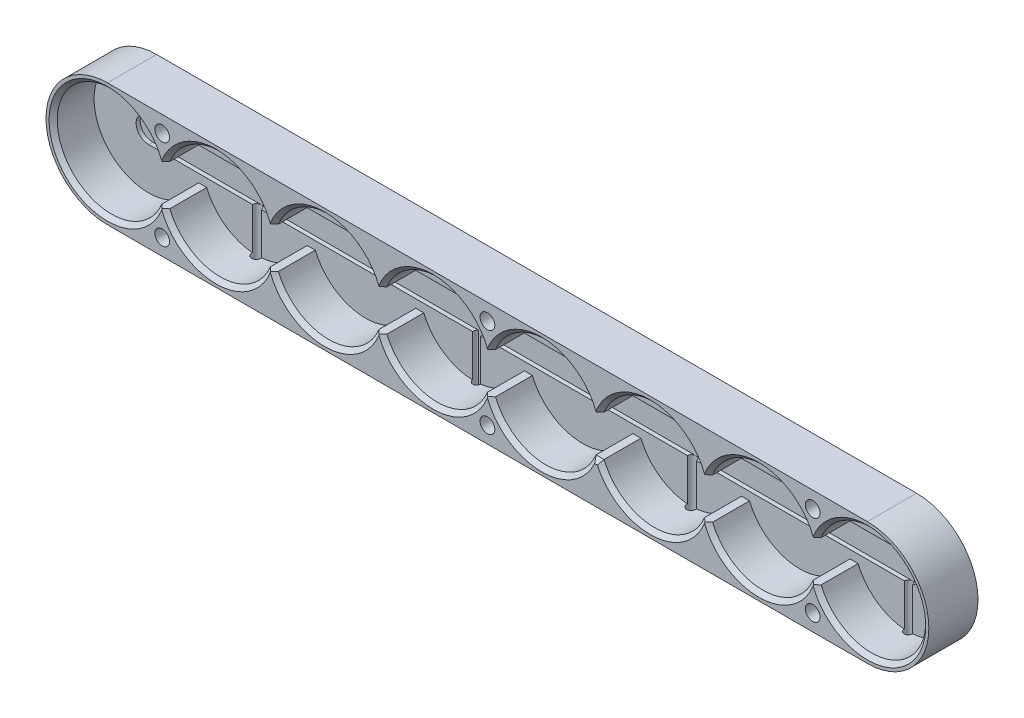
from build123d import *

# Parameters (mm, degrees)
BOSS_EXTRUDE1_DEPTH = 10
BOSS_EXTRUDE2_START = 2
BOSS_EXTRUDE2_DEPTH = 2
CHAMFER4_SIZE       = 1
SKETCH5_R           = 1.8
CUT_EXTRUDE2_DEPTH  = 12
SKETCH6_R           = 2.9
CUT_EXTRUDE3_DEPTH  = 4.5
CHAMFER5_SIZE       = 1.1
CUT_EXTRUDE6_DEPTH  = 1
SKETCH10_R          = 1.128354991
SKETCH10_R_2        = 1
CUT_EXTRUDE9_DEPTH  = 13


# Some blends are built 0.0001 mm under size
with BuildPart() as part:
    # Sketch1 → Boss-Extrude1 (new body)
    with BuildSketch(Plane.XY):
        with BuildLine():
            Line((185.5, 15), (0, 15))
            ThreePointArc((0, 15), (-15, 0), (0, -15))
            Line((0, -15), (185.5, -15))
            ThreePointArc((185.5, -15), (200.5, 0), (185.5, 15))
        make_face()
        with BuildLine():
            ThreePointArc((12.270391192, -5), (-13.25, 0), (12.270391192, 5))
            Line((12.270391192, 5), (14.229608808, 5))
            ThreePointArc((14.229608808, 5), (26.5, 13.25), (38.770391192, 5))
            Line((38.770391192, 5), (40.729608808, 5))
            ThreePointArc((40.729608808, 5), (53, 13.25), (65.270391192, 5))
            Line((65.270391192, 5), (67.229608808, 5))
            ThreePointArc((67.229608808, 5), (79.5, 13.25), (91.770391192, 5))
            Line((91.770391192, 5), (93.729608808, 5))
            ThreePointArc((93.729608808, 5), (106, 13.25), (118.270391192, 5))
            Line((118.270391192, 5), (120.229608808, 5))
            ThreePointArc((120.229608808, 5), (132.5, 13.25), (144.770391192, 5))
            Line((144.770391192, 5), (146.729608808, 5))
            ThreePointArc((146.729608808, 5), (159, 13.25), (171.270391192, 5))
            Line((171.270391192, 5), (173.229608808, 5))
            ThreePointArc((173.229608808, 5), (188.047529853, 13.002791687), (198.75, 0))
            ThreePointArc((198.75, 0), (188.047529853, -13.002791687), (173.229608808, -5))
            Line((173.229608808, -5), (171.270391192, -5))
            ThreePointArc((171.270391192, -5), (159, -13.25), (146.729608808, -5))
            Line((146.729608808, -5), (144.770391192, -5))
            ThreePointArc((144.770391192, -5), (132.5, -13.25), (120.229608808, -5))
            Line((120.229608808, -5), (118.270391192, -5))
            ThreePointArc((118.270391192, -5), (106, -13.25), (93.729608808, -5))
            Line((93.729608808, -5), (91.770391192, -5))
            ThreePointArc((91.770391192, -5), (79.5, -13.25), (67.229608808, -5))
            Line((67.229608808, -5), (65.270391192, -5))
            ThreePointArc((65.270391192, -5), (53, -13.25), (40.729608808, -5))
            Line((40.729608808, -5), (38.770391192, -5))
            ThreePointArc((38.770391192, -5), (26.5, -13.25), (14.229608808, -5))
            Line((14.229608808, -5), (12.270391192, -5))
        make_face(mode=Mode.SUBTRACT)
    extrude(amount=BOSS_EXTRUDE1_DEPTH)

    # Sketch2 → Boss-Extrude2 (add)
    with BuildSketch(Plane(origin=(0, 0, 0), x_dir=(-1, 0, 0), z_dir=(0, 0, -1)).offset(BOSS_EXTRUDE2_START)):
        with BuildLine():
            Line((0, -15), (-185.5, -15))
            ThreePointArc((-185.5, -15), (-200.5, 0), (-185.5, 15))
            Line((-185.5, 15), (0, 15))
            ThreePointArc((0, 15), (15, 0), (0, -15))
        make_face()
    extrude(amount=-BOSS_EXTRUDE2_DEPTH)

    # Chamfer4
    # the kernel refuses this chamfer: 1 mm, written as the material it takes off along each edge
    with BuildSketch(Plane(origin=(0, 0, 10), x_dir=(0.9816453862718537, -0.19071532610459777, 0), z_dir=(0.19071532610459777, 0.9816453862718537, 0))) as chamfer4_piece_1:
        Polygon((13.25 + CHAMFER4_SIZE, 0), (13.25, CHAMFER4_SIZE), (13.25, 0), align=None)
    revolve(axis=Axis((0, 0, 10), (0, 0, -1)), revolution_arc=338.010934506, mode=Mode.SUBTRACT)
    with BuildSketch(Plane(origin=(26.5, 0, 10), x_dir=(-0.9814953815696384, 0.1914858113737665, 0), z_dir=(-0.1914858113737665, -0.9814953815696384, 0))) as chamfer4_piece_2:
        Polygon((13.25 + CHAMFER4_SIZE, 0), (13.25, CHAMFER4_SIZE), (13.25, 0), align=None)
    revolve(axis=Axis((26.5, 0, 10), (0, 0, -1)), revolution_arc=157.92098568, mode=Mode.SUBTRACT)
    with BuildSketch(Plane(origin=(26.5, 0, 10), x_dir=(0.9814953815696384, -0.19148581137376705, 0), z_dir=(0.19148581137376705, 0.9814953815696384, 0))) as chamfer4_piece_3:
        Polygon((13.25 + CHAMFER4_SIZE, 0), (13.25, CHAMFER4_SIZE), (13.25, 0), align=None)
    revolve(axis=Axis((26.5, 0, 10), (0, 0, -1)), revolution_arc=157.92098568, mode=Mode.SUBTRACT)
    with BuildSketch(Plane(origin=(53, 0, 10), x_dir=(-0.9814953815696384, 0.1914858113737665, 0), z_dir=(-0.1914858113737665, -0.9814953815696384, 0))) as chamfer4_piece_4:
        Polygon((13.25 + CHAMFER4_SIZE, 0), (13.25, CHAMFER4_SIZE), (13.25, 0), align=None)
    revolve(axis=Axis((53, 0, 10), (0, 0, -1)), revolution_arc=157.92098568, mode=Mode.SUBTRACT)
    with BuildSketch(Plane(origin=(53, 0, 10), x_dir=(0.9814953815696383, -0.19148581137376733, 0), z_dir=(0.19148581137376733, 0.9814953815696383, 0))) as chamfer4_piece_5:
        Polygon((13.25 + CHAMFER4_SIZE, 0), (13.25, CHAMFER4_SIZE), (13.25, 0), align=None)
    revolve(axis=Axis((53, 0, 10), (0, 0, -1)), revolution_arc=157.92098568, mode=Mode.SUBTRACT)
    with BuildSketch(Plane(origin=(79.5, 0, 10), x_dir=(-0.9814953815696386, 0.1914858113737662, 0), z_dir=(-0.1914858113737662, -0.9814953815696386, 0))) as chamfer4_piece_6:
        Polygon((13.25 + CHAMFER4_SIZE, 0), (13.25, CHAMFER4_SIZE), (13.25, 0), align=None)
    revolve(axis=Axis((79.5, 0, 10), (0, 0, -1)), revolution_arc=157.92098568, mode=Mode.SUBTRACT)
    with BuildSketch(Plane(origin=(79.5, 0, 10), x_dir=(0.9814953815696384, -0.19148581137376663, 0), z_dir=(0.19148581137376663, 0.9814953815696384, 0))) as chamfer4_piece_7:
        Polygon((13.25 + CHAMFER4_SIZE, 0), (13.25, CHAMFER4_SIZE), (13.25, 0), align=None)
    revolve(axis=Axis((79.5, 0, 10), (0, 0, -1)), revolution_arc=157.92098568, mode=Mode.SUBTRACT)
    with BuildSketch(Plane(origin=(106, 0, 10), x_dir=(-0.9814953815696386, 0.1914858113737662, 0), z_dir=(-0.1914858113737662, -0.9814953815696386, 0))) as chamfer4_piece_8:
        Polygon((13.25 + CHAMFER4_SIZE, 0), (13.25, CHAMFER4_SIZE), (13.25, 0), align=None)
    revolve(axis=Axis((106, 0, 10), (0, 0, -1)), revolution_arc=157.92098568, mode=Mode.SUBTRACT)
    with BuildSketch(Plane(origin=(132.5, 0, 10), x_dir=(-0.9814953815696384, 0.19148581137376644, 0), z_dir=(-0.19148581137376644, -0.9814953815696384, 0))) as chamfer4_piece_9:
        Polygon((13.25 + CHAMFER4_SIZE, 0), (13.25, CHAMFER4_SIZE), (13.25, 0), align=None)
    revolve(axis=Axis((132.5, 0, 10), (0, 0, -1)), revolution_arc=157.92098568, mode=Mode.SUBTRACT)
    with BuildSketch(Plane(origin=(159, 0, 10), x_dir=(-0.9814953815696383, 0.19148581137376722, 0), z_dir=(-0.19148581137376722, -0.9814953815696383, 0))) as chamfer4_piece_10:
        Polygon((13.25 + CHAMFER4_SIZE, 0), (13.25, CHAMFER4_SIZE), (13.25, 0), align=None)
    revolve(axis=Axis((159, 0, 10), (0, 0, -1)), revolution_arc=157.92098568, mode=Mode.SUBTRACT)
    with BuildSketch(Plane(origin=(159, 0, 10), x_dir=(0.9814953815696382, -0.19148581137376783, 0), z_dir=(0.19148581137376783, 0.9814953815696382, 0))) as chamfer4_piece_11:
        Polygon((13.25 + CHAMFER4_SIZE, 0), (13.25, CHAMFER4_SIZE), (13.25, 0), align=None)
    revolve(axis=Axis((159, 0, 10), (0, 0, -1)), revolution_arc=157.92098568, mode=Mode.SUBTRACT)
    with BuildSketch(Plane(origin=(185.5, 0, 10), x_dir=(-0.9816453862718465, -0.19071532610463496, 0), z_dir=(-0.19071532610463496, 0.9816453862718465, 0))) as chamfer4_piece_12:
        Polygon((13.25 + CHAMFER4_SIZE, 0), (13.25, -CHAMFER4_SIZE), (13.25, 0), align=None)
    revolve(axis=Axis((185.5, 0, 10), (0, 0, 1)), revolution_arc=338.010934506, mode=Mode.SUBTRACT)
    with BuildSketch(Plane(origin=(106, 0, 10), x_dir=(0.9814953815696384, -0.19148581137376663, 0), z_dir=(0.19148581137376663, 0.9814953815696384, 0))) as chamfer4_piece_13:
        Polygon((13.25 + CHAMFER4_SIZE, 0), (13.25, CHAMFER4_SIZE), (13.25, 0), align=None)
    revolve(axis=Axis((106, 0, 10), (0, 0, -1)), revolution_arc=157.92098568, mode=Mode.SUBTRACT)
    with BuildSketch(Plane(origin=(132.5, 0, 10), x_dir=(0.9814953815696383, -0.19148581137376733, 0), z_dir=(0.19148581137376733, 0.9814953815696383, 0))) as chamfer4_piece_14:
        Polygon((13.25 + CHAMFER4_SIZE, 0), (13.25, CHAMFER4_SIZE), (13.25, 0), align=None)
    revolve(axis=Axis((132.5, 0, 10), (0, 0, -1)), revolution_arc=157.92098568, mode=Mode.SUBTRACT)
    with BuildSketch(Plane(origin=(122.801291796, -5, 10), x_dir=(0, -0.9996219169112968, 0.027495876610585623), z_dir=(-1, 0, 0))) as chamfer4_piece_15:
        Polygon((CHAMFER4_SIZE * 0.999621916911, -CHAMFER4_SIZE * 0.0274958766106), (-CHAMFER4_SIZE * 0.0274958766106, -CHAMFER4_SIZE * 0.999621916911), (0, 0), align=None)
    extrude(amount=7.102583592, mode=Mode.SUBTRACT)

    # Sketch5 → Cut-Extrude2 (cut)
    with BuildSketch(Plane.XY.offset(10)):
        with Locations((13.35, 11)):
            Circle(SKETCH5_R)
        with Locations((92.75, 11)):
            Circle(SKETCH5_R)
        with Locations((172.15, 11)):
            Circle(SKETCH5_R)
        with Locations((92.75, -11)):
            Circle(SKETCH5_R)
        with Locations((172.15, -11)):
            Circle(SKETCH5_R)
        with Locations((13.35, -11)):
            Circle(SKETCH5_R)
    extrude(amount=-CUT_EXTRUDE2_DEPTH, mode=Mode.SUBTRACT)

    # Sketch6 → Cut-Extrude3 (cut)
    with BuildSketch(Plane(origin=(0, 0, -2), x_dir=(-1, 0, 0), z_dir=(0, 0, -1))):
        with Locations((-13.35, 11)):
            Circle(SKETCH6_R)
        with Locations((-92.75, 11)):
            Circle(SKETCH6_R)
        with Locations((-172.15, 11)):
            Circle(SKETCH6_R)
        with Locations((-92.75, -11)):
            Circle(SKETCH6_R)
        with Locations((-172.15, -11)):
            Circle(SKETCH6_R)
        with Locations((-13.35, -11)):
            Circle(SKETCH6_R)
    extrude(amount=-CUT_EXTRUDE3_DEPTH, mode=Mode.SUBTRACT)

    # Chamfer5
    chamfer5_edges = [part.edges().sort_by_distance(p)[0] for p in [
        (16.25, -11, 2.5),
        (175.05, -11, 2.5),
        (95.65, -11, 2.5),
        (175.05, 11, 2.5),
        (95.65, 11, 2.5),
        (16.25, 11, 2.5),
    ]]
    chamfer(chamfer5_edges, length=CHAMFER5_SIZE - 0.0001)  # a hair under: the kernel refuses the full size

    # Sketch9 → Cut-Extrude6 (cut)
    with BuildSketch(Plane.XY):
        with BuildLine():
            Line((185.5, 3), (0.086805741, 3))
            ThreePointArc((0.086805741, 3), (-3.00125561, 0), (0.086805741, -3))
            Line((0.086805741, -3), (185.5, -3))
            ThreePointArc((185.5, -3), (188.5, 0), (185.5, 3))
        make_face()
    extrude(amount=-CUT_EXTRUDE6_DEPTH, mode=Mode.SUBTRACT)

    # Sketch10 → Cut-Extrude9 (cut)
    with BuildSketch(Plane.XZ.offset(15)):
        with Locations((132.662367023, 0.128354991)):
            Circle(SKETCH10_R)
        with Locations(Location((185.5, 0, 0), (0, 0, 270))):
            Circle(SKETCH10_R_2)
        with Locations((26.5, 0.128354991)):
            Circle(SKETCH10_R)
        with BuildLine():
            Line((79.611358313, -1), (80.589262077, -1))
            ThreePointArc((80.589262077, -1), (80.100310195, 0.872310757), (79.611358313, -1))
        make_face()
    extrude(amount=-CUT_EXTRUDE9_DEPTH, mode=Mode.SUBTRACT)


solid = part.part
